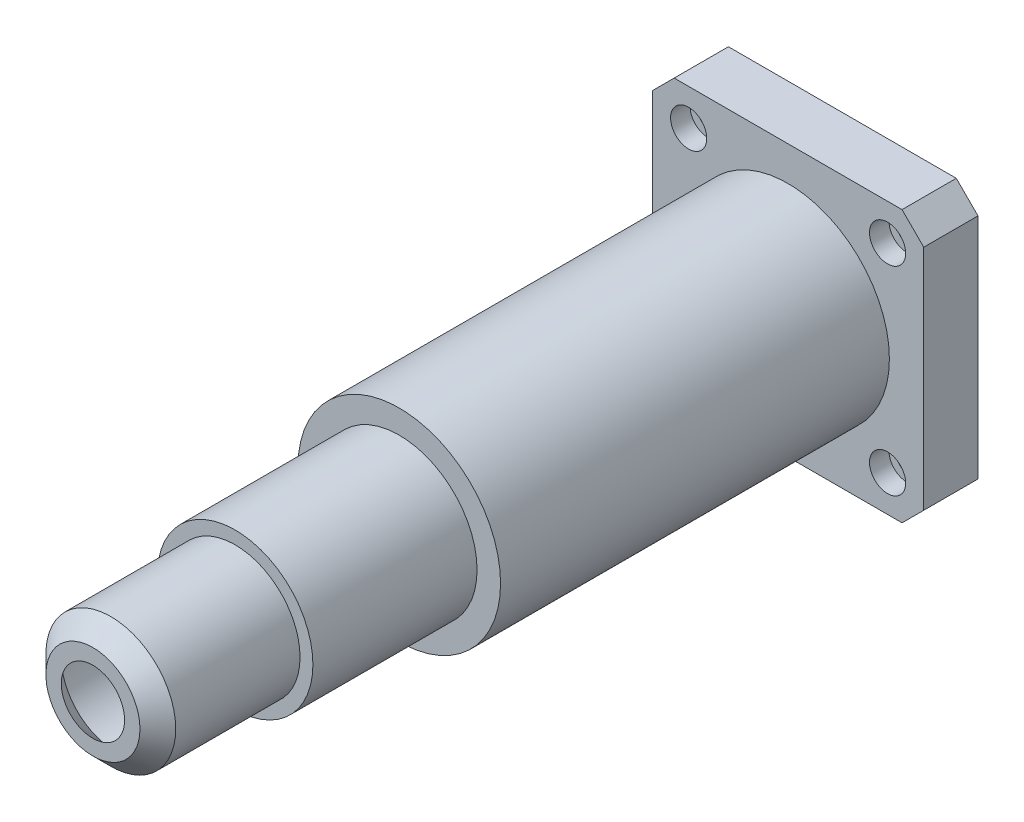
from build123d import *

# Parameters (mm, degrees)
SKETCH1_W                                           = 75
SKETCH1_H                                           = 75
BOSS_EXTRUDE1_DEPTH                                 = 15
SKETCH2_R                                           = 22
BOSS_EXTRUDE2_DEPTH                                 = 5
CBORE_FOR_M5_HEX_SOCKET_HEAD_CAP_SCREW1_D           = 5.5
CBORE_FOR_M5_HEX_SOCKET_HEAD_CAP_SCREW1_CBORE_D     = 10
CBORE_FOR_M5_HEX_SOCKET_HEAD_CAP_SCREW1_CBORE_DEPTH = 5.4
CIRPATTERN1_COUNT                                   = 4
CHAMFER1_SIZE                                       = 6
SHELL1_START                                        = 3
SHELL1_OUTLINE_R                                    = 25
SHELL1_DEPTH                                        = 116.5
SHELL1_START_2                                      = -5
SHELL1_2_OUTLINE_R                                  = 14.94492882
SHELL1_2_DEPTH                                      = 206.012430393
SHELL1_3_OUTLINE_R                                  = 18.5
SHELL1_3_OUTLINE_R_2                                = 14.94492882
SHELL1_3_DEPTH                                      = 169.882661511
SHELL1_4_OUTLINE_R                                  = 25
SHELL1_4_DEPTH                                      = 9
SHELL1_5_OUTLINE_R                                  = 5.75
SHELL1_5_DEPTH                                      = 3.6
SHELL1_6_OUTLINE_R                                  = 19
SHELL1_6_OUTLINE_R_2                                = 18.5
SHELL1_6_DEPTH                                      = 8


with BuildPart() as part:
    # Sketch1 → Boss-Extrude1 (new body)
    with BuildSketch(Plane.XY):
        Rectangle(SKETCH1_W, SKETCH1_H)
    extrude(amount=BOSS_EXTRUDE1_DEPTH)

    # Sketch2 → Boss-Extrude2 (add)
    with BuildSketch(Plane(origin=(0, 0, 0), x_dir=(-1, 0, 0), z_dir=(0, 0, -1))):
        Circle(SKETCH2_R)
    extrude(amount=BOSS_EXTRUDE2_DEPTH)

    # Sketch3 → Revolve1 (revolve)
    with BuildSketch(Plane(origin=(0, 0, 0), x_dir=(0, 0, -1), z_dir=(1, 0, 0)), mode=Mode.PRIVATE) as revolve1_sk:
        Polygon((-15, 28), (-122.5, 28), (-122.5, 21.5), (-167.882661511, 21.5), (-167.882661511, 17.94492882), (-202.25507118, 17.94492882), (-207.2, 13), (-207.2, 0), (-15, 0), align=None)
    revolve(revolve1_sk.sketch.rotate(Axis((0, 0, 207.2), (0, 0, -1)), 90), axis=Axis((0, 0, 207.2), (0, 0, -1)))

    # CBORE for M5 Hex Socket Head Cap Screw1 (through all)
    with Locations(Plane.XY.offset(15)):
        with Locations((-27.5, 27.5)):
            cbore_for_m5_hex_socket_head_cap_screw1 = CounterBoreHole(CBORE_FOR_M5_HEX_SOCKET_HEAD_CAP_SCREW1_D / 2, CBORE_FOR_M5_HEX_SOCKET_HEAD_CAP_SCREW1_CBORE_D / 2, CBORE_FOR_M5_HEX_SOCKET_HEAD_CAP_SCREW1_CBORE_DEPTH)

    # CirPattern1: CBORE for M5 Hex Socket Head Cap Screw1 ×4 about axis
    cirpattern1_axis = Axis((0, 0, 0), (0, 0, 1))
    for i in range(1, CIRPATTERN1_COUNT):
        add(cbore_for_m5_hex_socket_head_cap_screw1.rotate(cirpattern1_axis, i * 360 / CIRPATTERN1_COUNT), mode=Mode.SUBTRACT)

    # Chamfer1
    chamfer1_edges = [part.edges().sort_by_distance(p)[0] for p in [
        (37.5, -37.5, 7.5),
        (-37.5, -37.5, 7.5),
        (-37.5, 37.5, 7.5),
        (37.5, 37.5, 7.5),
    ]]
    chamfer(chamfer1_edges, length=CHAMFER1_SIZE)

    # Shell1: read off the stored shape, not the designer's step
    # Shell1 outline → Shell1 (cut)
    with BuildSketch(Plane.XY.offset(SHELL1_START)):
        Circle(SHELL1_OUTLINE_R)
    extrude(amount=SHELL1_DEPTH, mode=Mode.SUBTRACT)

    # Shell1 2 outline → Shell1 2 (cut)
    with BuildSketch(Plane.XY.offset(SHELL1_START_2)):
        Circle(SHELL1_2_OUTLINE_R)
    extrude(amount=SHELL1_2_DEPTH, mode=Mode.SUBTRACT)

    # Shell1 3 outline → Shell1 3 (cut)
    with BuildSketch(Plane.XY.offset(SHELL1_START_2)):
        Circle(SHELL1_3_OUTLINE_R)
        Circle(SHELL1_3_OUTLINE_R_2, mode=Mode.SUBTRACT)
    extrude(amount=SHELL1_3_DEPTH, mode=Mode.SUBTRACT)

    # Shell1 4 outline → Shell1 4 (cut)
    with BuildSketch(Plane.XY.offset(SHELL1_START)):
        with BuildLine():
            Line((-34.5, 23.627016654), (-34.5, -23.627016654))
            ThreePointArc((-34.5, -23.627016654), (-21.843145751, -21.843145751), (-23.627016654, -34.5))
            Line((-23.627016654, -34.5), (23.627016654, -34.5))
            ThreePointArc((23.627016654, -34.5), (21.843145751, -21.843145751), (34.5, -23.627016654))
            Line((34.5, -23.627016654), (34.5, 23.627016654))
            ThreePointArc((34.5, 23.627016654), (21.843145751, 21.843145751), (23.627016654, 34.5))
            Line((23.627016654, 34.5), (-23.627016654, 34.5))
            ThreePointArc((-23.627016654, 34.5), (-21.843145751, 21.843145751), (-34.5, 23.627016654))
        make_face()
        Circle(SHELL1_4_OUTLINE_R, mode=Mode.SUBTRACT)
    extrude(amount=SHELL1_4_DEPTH, mode=Mode.SUBTRACT)

    # Shell1 5 outline → Shell1 5 (cut)
    # profile 1 of 4: a face of its own
    with BuildSketch(Plane.XY.offset(SHELL1_START)):
        with BuildLine():
            Line((-34.5, -23.627016654), (-34.5, -30.257359313))
            Line((-34.5, -30.257359313), (-30.257359313, -34.5))
            Line((-30.257359313, -34.5), (-23.627016654, -34.5))
            ThreePointArc((-23.627016654, -34.5), (-21.843145751, -21.843145751), (-34.5, -23.627016654))
        make_face()
        with Locations((-27.5, -27.5)):
            Circle(SHELL1_5_OUTLINE_R, mode=Mode.SUBTRACT)
    # profile 2 of 4: a face of its own
    with BuildSketch(Plane.XY.offset(SHELL1_START)):
        with BuildLine():
            Line((-34.5, 30.257359313), (-34.5, 23.627016654))
            ThreePointArc((-34.5, 23.627016654), (-21.843145751, 21.843145751), (-23.627016654, 34.5))
            Line((-23.627016654, 34.5), (-30.257359313, 34.5))
            Line((-30.257359313, 34.5), (-34.5, 30.257359313))
        make_face()
        with Locations((-27.5, 27.5)):
            Circle(SHELL1_5_OUTLINE_R, mode=Mode.SUBTRACT)
    # profile 3 of 4: a face of its own
    with BuildSketch(Plane.XY.offset(SHELL1_START)):
        with BuildLine():
            ThreePointArc((34.5, -23.627016654), (21.843145751, -21.843145751), (23.627016654, -34.5))
            Line((23.627016654, -34.5), (30.257359313, -34.5))
            Line((30.257359313, -34.5), (34.5, -30.257359313))
            Line((34.5, -30.257359313), (34.5, -23.627016654))
        make_face()
        with Locations((27.5, -27.5)):
            Circle(SHELL1_5_OUTLINE_R, mode=Mode.SUBTRACT)
    # profile 4 of 4: a face of its own
    with BuildSketch(Plane.XY.offset(SHELL1_START)):
        with BuildLine():
            Line((30.257359313, 34.5), (23.627016654, 34.5))
            ThreePointArc((23.627016654, 34.5), (21.843145751, 21.843145751), (34.5, 23.627016654))
            Line((34.5, 23.627016654), (34.5, 30.257359313))
            Line((34.5, 30.257359313), (30.257359313, 34.5))
        make_face()
        with Locations((27.5, 27.5)):
            Circle(SHELL1_5_OUTLINE_R, mode=Mode.SUBTRACT)
    extrude(amount=SHELL1_5_DEPTH, mode=Mode.SUBTRACT)

    # Shell1 6 outline → Shell1 6 (cut)
    with BuildSketch(Plane.XY.offset(SHELL1_START_2)):
        Circle(SHELL1_6_OUTLINE_R)
        Circle(SHELL1_6_OUTLINE_R_2, mode=Mode.SUBTRACT)
    extrude(amount=SHELL1_6_DEPTH, mode=Mode.SUBTRACT)

    # Shell1 7 outline → Shell1 7 (revolve, cut)
    with BuildSketch(Plane.XZ):
        Polygon((0, 201.012430393), (14.94492882, 201.012430426), (8.757359313, 207.2), (0, 207.2), align=None)
    revolve(axis=Axis((0, 0, 0), (0, 0, 1)), mode=Mode.SUBTRACT)


solid = part.part
